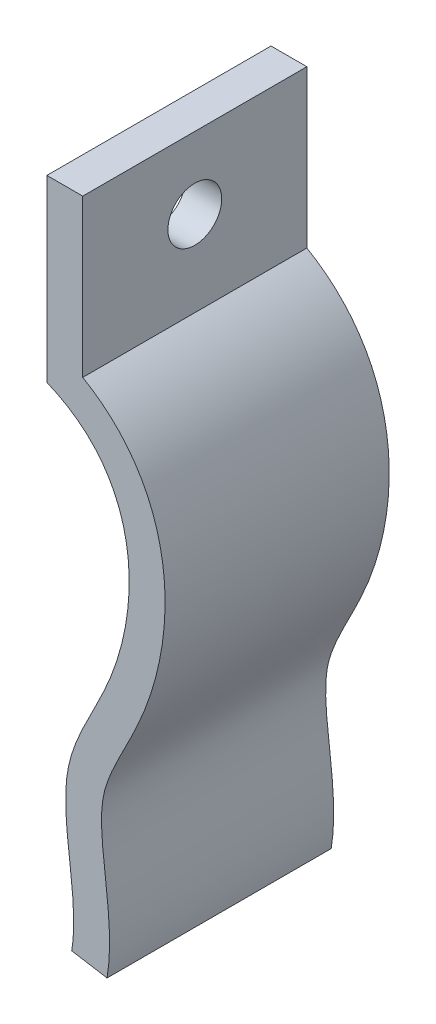
from build123d import *

# Parameters (mm, degrees)
Y_KSEKLIK_EKSTR_ZYON1_DEPTH = 25
IZIM2_R                     = 3
KES_EKSTR_ZYON1_DEPTH       = 25


with BuildPart() as part:
    # Çizim1 → Yükseklik-Ekstrüzyon1 (new body)
    with BuildSketch(Plane.XY):
        with BuildLine():
            Line((0, 41.809932088), (0, 21.809932088))
            add(Edge.make_bspline(
                [(0, 21.809932088), (10.568682784, 17.485267601), (10.861510075, 0.820586193), (0.998345772, -13.725400391), (2.795894005, -23.640205996), (3.121098113, -29.579949129), (2.768427288, -31.706876061)],
                knots=[0, 0, 0, 0, 0.502231834, 0.695448005, 0.885832632, 1, 1, 1, 1], degree=3))
            Line((2.768427288, -31.706876061), (6.714548286, -32.36119179))
            add(Edge.make_bspline(
                [(4, 24.2963952), (4.685241485, 23.900375179), (6.022043302, 23.011317955), (8.333925315, 20.992557914), (10.609017408, 18.030861677), (12.32636561, 14.066160517), (13.159459329, 9.910750093), (13.24989148, 5.701775618), (12.718641949, 1.530842244), (11.833086969, -1.848590972), (10.899012363, -4.452139312), (9.810416195, -6.984529937), (8.372727065, -9.758751694), (7.204267261, -12.146452944), (6.575072484, -13.855163917), (6.277947315, -15.001021013), (6.121386741, -16.210975711), (6.065175757, -18.048049204), (6.266564263, -20.67501448), (6.722421217, -24.235274395), (7.01194691, -27.479985961), (6.982841835, -30.215107384), (6.831247592, -31.657388466), (6.714548286, -32.36119179)],
                knots=[0.033864542, 0.033864542, 0.033864542, 0.033864542, 0.064056275, 0.094248008, 0.154631474, 0.21501494, 0.275398406, 0.335781873, 0.396165339, 0.456548805, 0.486740538, 0.516932271, 0.577315737, 0.637699203, 0.667890936, 0.698082669, 0.728274402, 0.758466135, 0.818849602, 0.879233068, 0.939616534, 0.969808267, 1, 1, 1, 1], degree=3))
            Line((4, 24.2963952), (4, 41.809932088))
            Line((4, 41.809932088), (0, 41.809932088))
        make_face()
    extrude(amount=Y_KSEKLIK_EKSTR_ZYON1_DEPTH)

    # Çizim2 → Kes-Ekstrüzyon1 (cut)
    with BuildSketch(Plane(origin=(4, 0, 0), x_dir=(0, 0, -1), z_dir=(1, 0, 0))):
        with Locations((-12.5, 33.809932088)):
            Circle(IZIM2_R)
    extrude(amount=-KES_EKSTR_ZYON1_DEPTH, mode=Mode.SUBTRACT)


solid = part.part
